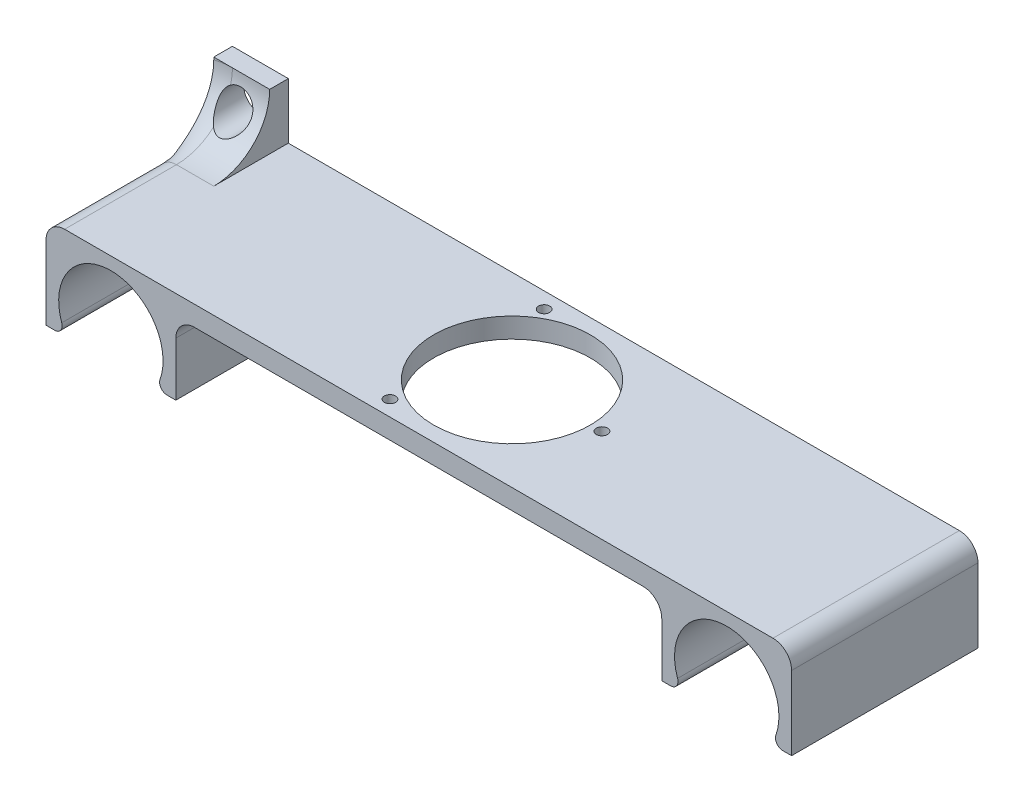
from build123d import *

# Parameters (mm, degrees)
SKETCH1_R           = 14
BOSS_EXTRUDE1_DEPTH = 50
SKETCH2_R           = 21
CUT_EXTRUDE1_DEPTH  = 45
SKETCH3_R           = 1.5
CUT_EXTRUDE2_DEPTH  = 45
SKETCH4_W           = 15
SKETCH4_H           = 15
BOSS_EXTRUDE2_DEPTH = 5
SKETCH5_R           = 4.5
CUT_EXTRUDE3_DEPTH  = 5
FILLET1_R           = 5
FILLET2_R           = 15
SKETCH7_W           = 200
SKETCH7_H           = 10
CUT_EXTRUDE4_DEPTH  = 50
FILLET3_R           = 2


with BuildPart() as part:
    # Sketch1 → Boss-Extrude1 (new body)
    with BuildSketch(Plane.XY):
        Polygon((-50, 17.4), (-15.2, 17.4), (50, 17.4), (50, 12.022605171), (-15.17275181, 12.022605171), (-15.17275181, -17.4), (-50, -17.4), align=None)
        with Locations((-32.6, 0)):
            Circle(SKETCH1_R, mode=Mode.SUBTRACT)
    boss_extrude1 = extrude(amount=BOSS_EXTRUDE1_DEPTH)

    # Mirror1: Boss-Extrude1 across plane
    add(boss_extrude1.mirror(Plane(origin=(50, 17.4, 50), x_dir=(0, 0, 1), z_dir=(-1, 0, 0))))

    # Sketch2 → Cut-Extrude1 (cut)
    with BuildSketch(Plane(origin=(0, 17.4, 0), x_dir=(1, 0, 0), z_dir=(0, 1, 0))):
        with Locations(Location((50, -25, 0), (0, 0, 270))):
            Circle(SKETCH2_R)
    extrude(amount=-CUT_EXTRUDE1_DEPTH, mode=Mode.SUBTRACT)

    # Sketch3 → Cut-Extrude2 (cut)
    with BuildSketch(Plane(origin=(0, 17.4, 0), x_dir=(1, 0, 0), z_dir=(0, 1, 0))):
        with Locations(Location((37.89578471, -4.273302643, 0), (0, 0, 270))):
            Circle(SKETCH3_R)
        with Locations(Location((74.001954093, -24.880790745, 0), (0, 0, 270))):
            Circle(SKETCH3_R)
        with Locations(Location((38.102261197, -45.845906612, 0), (0, 0, 270))):
            Circle(SKETCH3_R)
    extrude(amount=-CUT_EXTRUDE2_DEPTH, mode=Mode.SUBTRACT)

    # Sketch4 → Boss-Extrude2 (add)
    with BuildSketch(Plane(origin=(0, 0, 0), x_dir=(-1, 0, 0), z_dir=(0, 0, -1))):
        with Locations((42.5, 24.9)):
            Rectangle(SKETCH4_W, SKETCH4_H)
    extrude(amount=-BOSS_EXTRUDE2_DEPTH)

    # Sketch5 → Cut-Extrude3 (cut)
    with BuildSketch(Plane(origin=(0, 0, 0), x_dir=(-1, 0, 0), z_dir=(0, 0, -1))):
        with Locations((42.5, 24.9)):
            Circle(SKETCH5_R)
    extrude(amount=-CUT_EXTRUDE3_DEPTH, mode=Mode.SUBTRACT)

    # Fillet1
    fillet1_edges = [part.edges().sort_by_distance(p)[0] for p in [
        (-50, 17.4, 27.5),
        (-15.17275181, 12.022605171, 25),
        (-15.17275181, -17.4, 25),
        (-50, -17.4, 25),
        (150, -17.4, 25),
        (150, 17.4, 25),
        (115.17275181, 12.022605171, 25),
        (115.17275181, -17.4, 25),
    ]]
    fillet(fillet1_edges, radius=FILLET1_R)

    # Fillet2
    # the kernel refuses this fillet: 15 mm, written as the material it adds along each edge
    with BuildSketch(Plane(origin=(-45, 12.4, 5), x_dir=(0, 1, 0), z_dir=(1, 0, 0))) as fillet2_piece_1_section:
        with BuildLine():
            CenterArc((5 + FILLET2_R, FILLET2_R), FILLET2_R, 180, 90)
            Line((5 + FILLET2_R, 0), (5, 0))
            Line((5, 0), (5, FILLET2_R))
        make_face()
    fillet2_piece_1 = revolve(axis=Axis((-45, 12.4, 5), (0, 0, 1)), revolution_arc=359.64, mode=Mode.PRIVATE)
    fillet2_piece_1 = split(fillet2_piece_1, bisect_by=Plane(origin=(-50, 16.22028394, 10.678167657), z_dir=(1, 0, 0)), keep=Keep.TOP, mode=Mode.PRIVATE)
    fillet2_piece_1 = fillet2_piece_1 - Plane(origin=(-42.5, 24.9, 10.678167657), x_dir=(-1, 0, 0), z_dir=(0, 0, -1)) * Cylinder(4.5, 80, mode=Mode.PRIVATE)
    fillet2_piece_1 = fillet2_piece_1 - Plane(origin=(-32.6, 0, 10.678167657), x_dir=(1, 0, 0), z_dir=(0, 0, -1)) * Cylinder(14, 80, mode=Mode.PRIVATE)
    fillet2_piece_1 = split(fillet2_piece_1, bisect_by=Plane(origin=(-35, 16.22028394, 10.678167657), z_dir=(-1, 0, 0)), keep=Keep.TOP, mode=Mode.PRIVATE)
    add(fillet2_piece_1)
    with BuildSketch(Plane(origin=(-45, 17.4, 5), x_dir=(0, 0, 1), z_dir=(1, 0, 0))) as fillet2_piece_2_section:
        with BuildLine():
            CenterArc((FILLET2_R, -FILLET2_R), FILLET2_R, 90, 90)
            Line((0, -FILLET2_R), (0, 0))
            Line((0, 0), (FILLET2_R, 0))
        make_face()
    fillet2_piece_2 = extrude(amount=10, mode=Mode.PRIVATE)
    fillet2_piece_2 = fillet2_piece_2 - Plane(origin=(-42.5, 24.9, 8.942844525), x_dir=(-1, 0, 0), z_dir=(0, 0, -1)) * Cylinder(4.5, 80, mode=Mode.PRIVATE)
    add(fillet2_piece_2)

    # Sketch7 → Cut-Extrude4 (cut)
    with BuildSketch(Plane(origin=(0, 0, 0), x_dir=(-1, 0, 0), z_dir=(0, 0, -1))):
        with Locations((-50, -12.4)):
            Rectangle(SKETCH7_W, SKETCH7_H)
    extrude(amount=-CUT_EXTRUDE4_DEPTH, mode=Mode.SUBTRACT)

    # Fillet3
    fillet3_edges = [part.edges().sort_by_distance(p)[0] for p in [
        (120.715556387, -7.4, 25),
        (144.484443613, -7.4, 25),
        (-20.715556387, -7.4, 25),
        (-44.484443613, -7.4, 25),
    ]]
    fillet(fillet3_edges, radius=FILLET3_R)


solid = part.part
